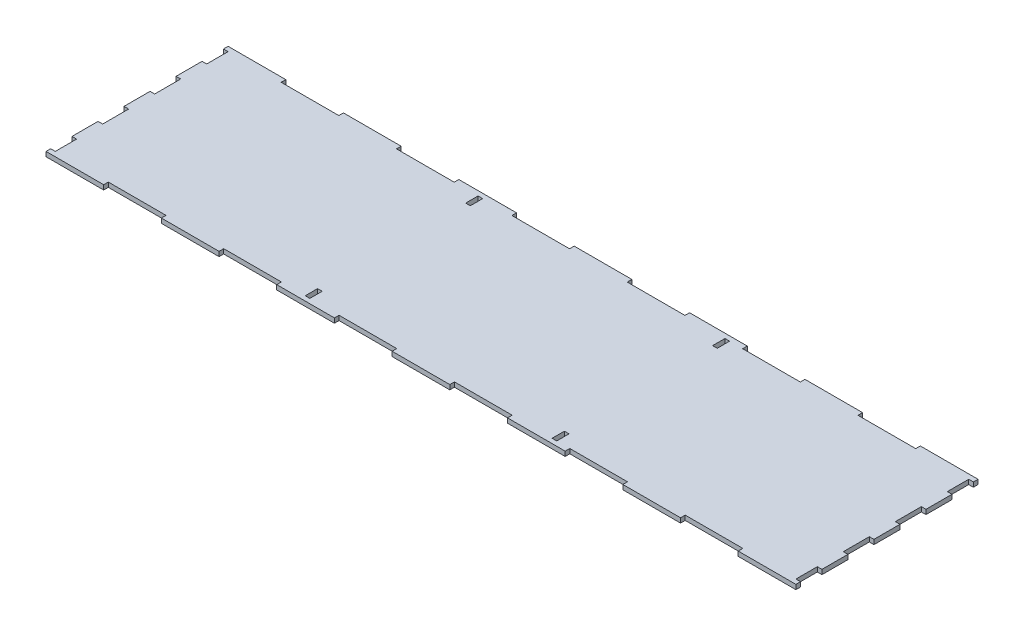
from build123d import *

# Parameters (mm, degrees)
BOSS_EXTRUDE1_DEPTH = 4.7625
SKETCH2_W           = 4.7625
SKETCH2_H           = 12.7
CUT_EXTRUDE1_DEPTH  = 397.998805689


with BuildPart() as part:
    # Sketch1 → Boss-Extrude1 (new body)
    with BuildSketch(Plane(origin=(0, 0, 0), x_dir=(1, 0, 0), z_dir=(0, 1, 0))):
        Polygon((89.022115385, 88.9), (29.674038462, 88.9), (29.674038462, 93.6625), (-29.674038462, 93.6625), (-29.674038462, 88.9), (-89.022115385, 88.9), (-89.022115385, 93.6625), (-148.370192308, 93.6625), (-148.370192308, 88.9), (-207.718269231, 88.9), (-207.718269231, 93.6625), (-267.066346154, 93.6625), (-267.066346154, 88.9), (-326.414423077, 88.9), (-326.414423077, 93.6625), (-385.7625, 93.6625), (-385.7625, 88.9), (-381, 88.9), (-381, 66.901785714), (-385.7625, 66.901785714), (-385.7625, 40.141071429), (-381, 40.141071429), (-381, 13.380357143), (-385.7625, 13.380357143), (-385.7625, -13.380357143), (-381, -13.380357143), (-381, -40.141071429), (-385.7625, -40.141071429), (-385.7625, -66.901785714), (-381, -66.901785714), (-381, -88.9), (-385.7625, -88.9), (-385.7625, -93.6625), (-326.414423077, -93.6625), (-326.414423077, -88.9), (-267.066346154, -88.9), (-267.066346154, -93.6625), (-207.718269231, -93.6625), (-207.718269231, -88.9), (-148.370192308, -88.9), (-148.370192308, -93.6625), (-89.022115385, -93.6625), (-89.022115385, -88.9), (-29.674038462, -88.9), (-29.674038462, -93.6625), (29.674038462, -93.6625), (29.674038462, -88.9), (89.022115385, -88.9), (89.022115385, -93.6625), (148.370192308, -93.6625), (148.370192308, -88.9), (207.718269231, -88.9), (207.718269231, -93.6625), (267.066346154, -93.6625), (267.066346154, -88.9), (326.414423077, -88.9), (326.414423077, -93.6625), (381, -93.6625), (385.7625, -93.6625), (385.7625, -88.9), (381, -88.9), (381, -66.901785714), (385.7625, -66.901785714), (385.7625, -40.141071429), (381, -40.141071429), (381, -13.380357143), (385.7625, -13.380357143), (385.7625, 13.380357143), (381, 13.380357143), (381, 40.141071429), (385.7625, 40.141071429), (385.7625, 66.901785714), (381, 66.901785714), (381, 88.9), (385.7625, 88.9), (385.7625, 93.6625), (326.414423077, 93.6625), (326.414423077, 88.9), (267.066346154, 88.9), (267.066346154, 93.6625), (207.718269231, 93.6625), (207.718269231, 88.9), (148.370192308, 88.9), (148.370192308, 93.6625), (89.022115385, 93.6625), align=None)
    extrude(amount=BOSS_EXTRUDE1_DEPTH)

    # Sketch2 → Cut-Extrude1 (cut, through all)
    with BuildSketch(Plane(origin=(0, 4.7625, 0), x_dir=(1, 0, 0), z_dir=(0, 1, 0))):
        with Locations((-121.44375, 82.55)):
            Rectangle(SKETCH2_W, SKETCH2_H)
        with Locations((-121.44375, -82.55)):
            Rectangle(SKETCH2_W, SKETCH2_H)
        with Locations((132.55625, 82.55)):
            Rectangle(SKETCH2_W, SKETCH2_H)
        with Locations((132.55625, -82.55)):
            Rectangle(SKETCH2_W, SKETCH2_H)
    extrude(amount=-CUT_EXTRUDE1_DEPTH, mode=Mode.SUBTRACT)


solid = part.part
